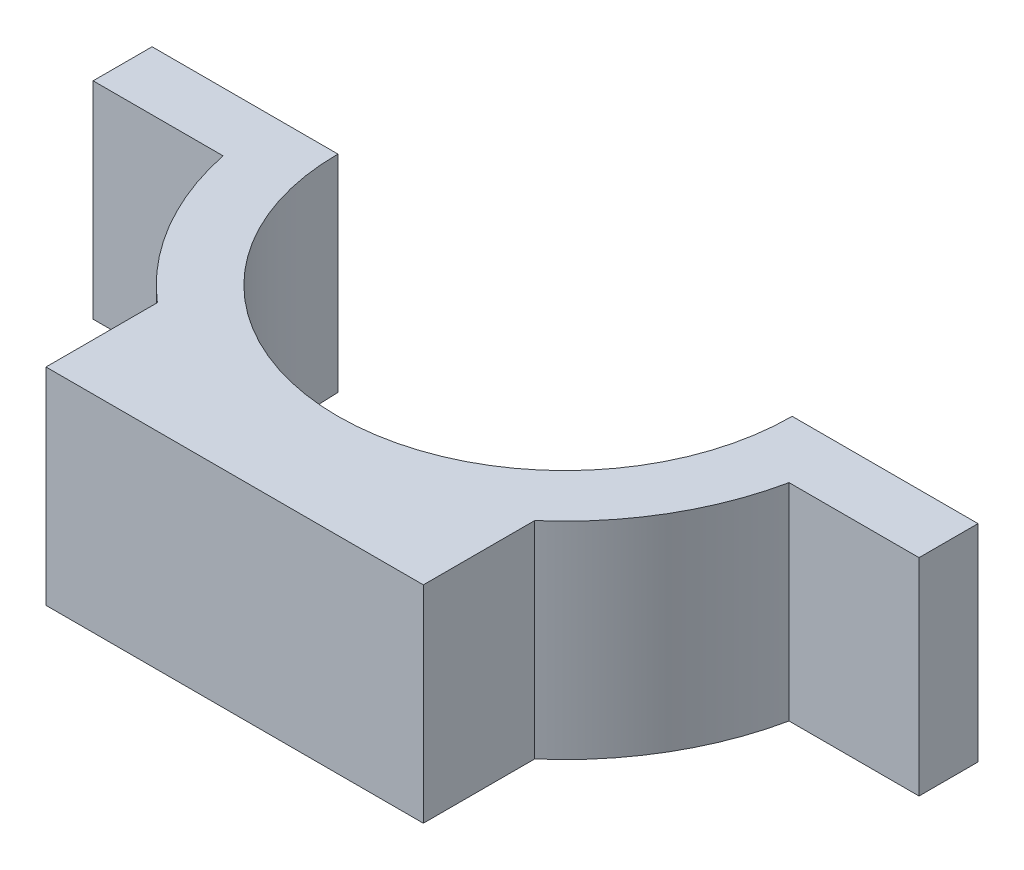
from build123d import *

# Parameters (mm, degrees)
BOSS_EXTRUDE1_DEPTH = 50
SKETCH3_W           = 14.282150027
SKETCH3_H           = 50
BOSS_EXTRUDE2_DEPTH = 100
CUT_EXTRUDE3_START  = -200
SKETCH10_R          = 55
CUT_EXTRUDE3_DEPTH  = 200
SKETCH11_W          = 91.379110146
SKETCH11_H          = 50
BOSS_EXTRUDE4_DEPTH = 80
CUT_EXTRUDE4_START  = -200
SKETCH12_R          = 55
CUT_EXTRUDE4_DEPTH  = 200


with BuildPart() as part:
    # Sketch1 → Boss-Extrude1 (new body)
    with BuildSketch(Plane(origin=(0, 0, 0), x_dir=(1, 0, 0), z_dir=(0, 1, 0))):
        with BuildLine():
            ThreePointArc((-70, 0), (0, -70), (70, 0))
            Line((70, 0), (55, 0))
            ThreePointArc((55, 0), (0, -55), (-55, 0))
            Line((-55, 0), (-70, 0))
        make_face()
    extrude(amount=BOSS_EXTRUDE1_DEPTH)

    # Sketch3 → Boss-Extrude2 (add, symmetric)
    with BuildSketch(Plane(origin=(0, 0, 0), x_dir=(0, 0, -1), z_dir=(1, 0, 0))):
        with Locations((-7.141075014, 25)):
            Rectangle(SKETCH3_W, SKETCH3_H)
    extrude(amount=BOSS_EXTRUDE2_DEPTH, both=True)

    # Sketch10 → Cut-Extrude3 (cut)
    with BuildSketch(Plane(origin=(0, 50, 0), x_dir=(1, 0, 0), z_dir=(0, 1, 0)).offset(CUT_EXTRUDE3_START)):
        Circle(SKETCH10_R)
    extrude(amount=CUT_EXTRUDE3_DEPTH, mode=Mode.SUBTRACT)

    # Sketch11 → Boss-Extrude4 (add)
    with BuildSketch(Plane.XY):
        with Locations((0, 25)):
            Rectangle(SKETCH11_W, SKETCH11_H)
    extrude(amount=BOSS_EXTRUDE4_DEPTH)

    # Sketch12 → Cut-Extrude4 (cut)
    with BuildSketch(Plane(origin=(0, 50, 0), x_dir=(1, 0, 0), z_dir=(0, 1, 0)).offset(CUT_EXTRUDE4_START)):
        Circle(SKETCH12_R)
    extrude(amount=CUT_EXTRUDE4_DEPTH, mode=Mode.SUBTRACT)


solid = part.part
